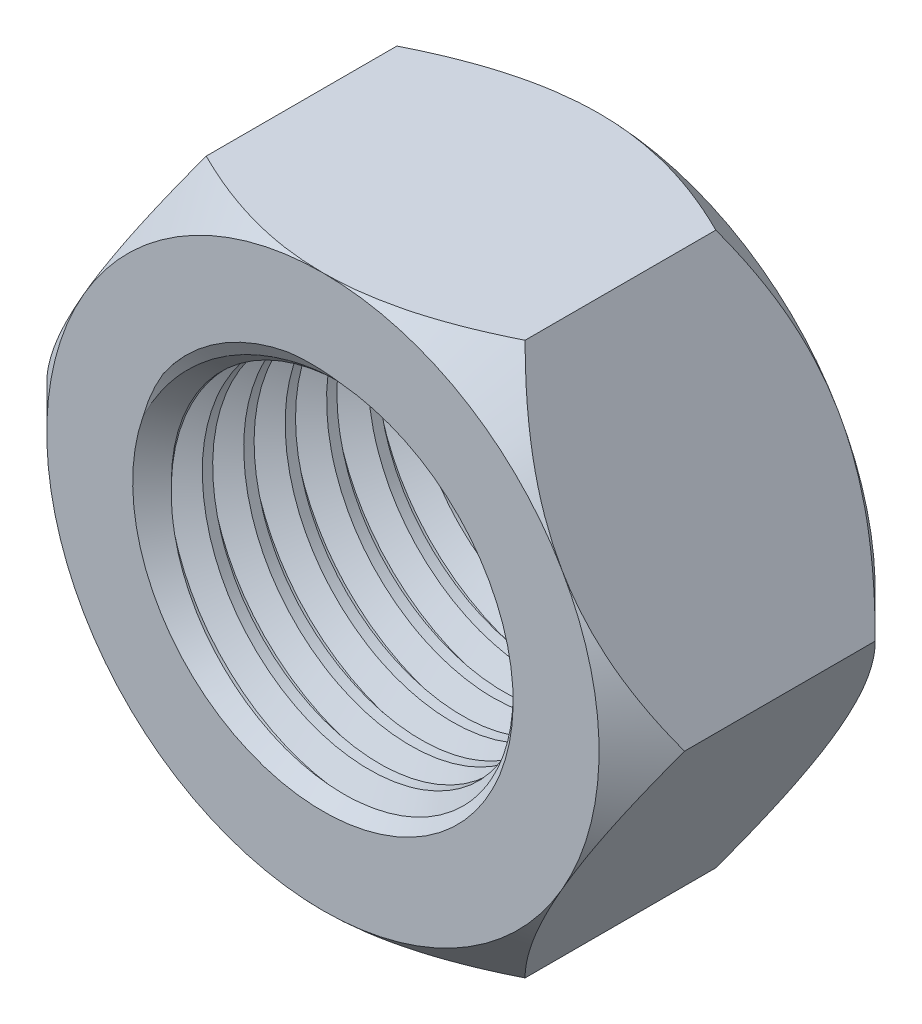
from build123d import *

# Parameters (mm, degrees)
BOSS_EXTRUDE1_DEPTH     = 5
SKETCH2_OUTSIDE_W       = 70.038
SKETCH2_OUTSIDE_H       = 66.944
SKETCH2_OUTSIDE_R       = 10
CUT_EXTRUDE1_DEPTH      = 19.257418584
CUT_EXTRUDE1_DRAFT      = -45
MIRROR1_COPY_1_SKETCH_W = 70.038
MIRROR1_COPY_1_SKETCH_H = 66.944
MIRROR1_COPY_1_SKETCH_R = 10
MIRROR1_COPY_1_DEPTH    = 19.257418584
MIRROR1_COPY_1_DRAFT    = -45
SKETCH3_R               = 6.1881
CUT_EXTRUDE2_DEPTH      = 19.257418584
CHAMFER1_SIZE           = 0.7
THREAD1_PITCH           = 1.5


with BuildPart() as part:
    # Sketch1 → Boss-Extrude1 (new, symmetric)
    with BuildSketch(Plane.XY):
        Polygon((5.773502692, -10), (11.547005384, 0), (5.773502692, 10), (-5.773502692, 10), (-11.547005384, 0), (-5.773502692, -10), align=None)
    extrude(amount=BOSS_EXTRUDE1_DEPTH, both=True)


with BuildPart() as cut_extrude1_tool:
    # Sketch2 outside → Cut-Extrude1 (with draft: the straight prism first)
    with BuildSketch(Plane.XY.offset(5)):
        Rectangle(SKETCH2_OUTSIDE_W, SKETCH2_OUTSIDE_H)
        Circle(SKETCH2_OUTSIDE_R, mode=Mode.SUBTRACT)
    extrude(amount=-CUT_EXTRUDE1_DEPTH)
    # Cut-Extrude1: the draft: its side faces are tilted about the plane it starts from
    cut_extrude1_sides = [cut_extrude1_tool.faces().sort_by_distance(p)[0] for p in [
        (0, -33.472, -4.628709292),
        (35.019, 0, -4.628709292),
        (0, 33.472, -4.628709292),
        (-35.019, 0, -4.628709292),
        (-10, 0, -4.628709292),
    ]]
    draft(cut_extrude1_sides, Plane.XY.offset(5), CUT_EXTRUDE1_DRAFT)


with BuildPart() as part_1:
    add(part.part)

    # Cut-Extrude1: cut by cut_extrude1_tool
    add(cut_extrude1_tool.part, mode=Mode.SUBTRACT)


with BuildPart() as mirror1_copy_1_tool:
    # Mirror1 copy 1 sketch → Mirror1 copy 1 (with draft: the straight prism first)
    with BuildSketch(Plane(origin=(0, 0, -5), x_dir=(1, 0, 0), z_dir=(0, 0, -1))):
        Rectangle(MIRROR1_COPY_1_SKETCH_W, MIRROR1_COPY_1_SKETCH_H)
        Circle(MIRROR1_COPY_1_SKETCH_R, mode=Mode.SUBTRACT)
    extrude(amount=-MIRROR1_COPY_1_DEPTH)
    # Mirror1 copy 1: the draft: its side faces are tilted about the plane it starts from
    mirror1_copy_1_sides = [mirror1_copy_1_tool.faces().sort_by_distance(p)[0] for p in [
        (0, -33.472, 4.628709292),
        (35.019, 0, 4.628709292),
        (0, 33.472, 4.628709292),
        (-35.019, 0, 4.628709292),
        (-10, 0, 4.628709292),
    ]]
    draft(mirror1_copy_1_sides, Plane(origin=(0, 0, -5), x_dir=(1, 0, 0), z_dir=(0, 0, -1)), MIRROR1_COPY_1_DRAFT)


with BuildPart() as part_2:
    add(part_1.part)

    # Mirror1 copy 1: cut by mirror1_copy_1_tool
    add(mirror1_copy_1_tool.part, mode=Mode.SUBTRACT)

    # Sketch3 → Cut-Extrude2 (cut, through all)
    with BuildSketch(Plane.XY.offset(5)):
        Circle(SKETCH3_R)
    extrude(amount=-CUT_EXTRUDE2_DEPTH, mode=Mode.SUBTRACT)

    # Chamfer1
    chamfer1_edges = [part_2.edges().sort_by_distance(p)[0] for p in [
        (-6.1881, 0, -5),
        (-6.1881, 0, 5),
    ]]
    chamfer(chamfer1_edges, length=CHAMFER1_SIZE)

    # Thread1: the profile of Thread Profile1 profile screwed along a right-hand helix of 8.2 turns, 8 arcs to a turn; built about Z, then put on its axis
    thread1_z = Axis((0, 0, 0), (0, 0, 1))
    thread1_corners = [(6.1878, 0, -0.000173205), (6.999998813, 0, 0.468749998), (6.999998813, 0, 0.656249998), (6.1878, 0, 1.125173201)]
    with BuildLine(mode=Mode.PRIVATE) as thread1_profile:
        Line(thread1_corners[0], thread1_corners[1])
        Line(thread1_corners[1], thread1_corners[2])
        Line(thread1_corners[2], thread1_corners[3])
        Line(thread1_corners[3], thread1_corners[0])
    thread1_cap = Face(thread1_profile.wire())
    thread1_turn_angles = [0, 22.5, 45, 67.5, 90, 112.5, 135, 157.5, 180, 202.5, 225, 247.5, 270, 292.5, 315, 337.5, 360]
    thread1_turn_weights = [1, 0.9238795325112867, 1, 0.9238795325112867, 1, 0.9238795325112867, 1, 0.9238795325112867, 1, 0.9238795325112867, 1, 0.9238795325112867, 1, 0.9238795325112867, 1, 0.9238795325112867, 1]
    thread1_turn_rails = [Edge.make_bspline([Vector(p[0], p[1], 0).rotate(thread1_z, thread1_turn_angles[k]) / thread1_turn_weights[k] + Vector(0, 0, p[2] + THREAD1_PITCH * thread1_turn_angles[k] / 360) for k in range(17)], [0, 0, 0, 1, 1, 2, 2, 3, 3, 4, 4, 5, 5, 6, 6, 7, 7, 8, 8, 8], 2, thread1_turn_weights) for p in thread1_corners]
    thread1_turn_sides = [Face.make_surface_from_curves(thread1_turn_rails[p[0]], thread1_turn_rails[p[1]]) for p in [(0, 1), (1, 2), (2, 3), (3, 0)]]
    thread1_last_angles = [2880, 2902.5, 2925, 2938.5, 2952]
    thread1_last_weights = [1, 0.9238795325112867, 1, 0.9723699203976812, 1]
    thread1_last_rails = [Edge.make_bspline([Vector(p[0], p[1], 0).rotate(thread1_z, thread1_last_angles[k]) / thread1_last_weights[k] + Vector(0, 0, p[2] + THREAD1_PITCH * thread1_last_angles[k] / 360) for k in range(5)], [0, 0, 0, 1, 1, 2, 2, 2], 2, thread1_last_weights) for p in thread1_corners]
    thread1_last_sides = [Face.make_surface_from_curves(thread1_last_rails[p[0]], thread1_last_rails[p[1]]) for p in [(0, 1), (1, 2), (2, 3), (3, 0)]]
    thread1 = Plane(origin=(0, 0, 7.3), x_dir=(-1, 0, 0), z_dir=(0, 0, -1)) * Solid(Shell([*[p.moved(Location((0, 0, THREAD1_PITCH * i))) for i in range(8) for p in thread1_turn_sides], *thread1_last_sides, thread1_cap, thread1_cap.rotate(thread1_z, 2952).moved(Location((0, 0, THREAD1_PITCH * 2952 / 360)))]))
    add(thread1, mode=Mode.SUBTRACT)


solid = part_2.part
